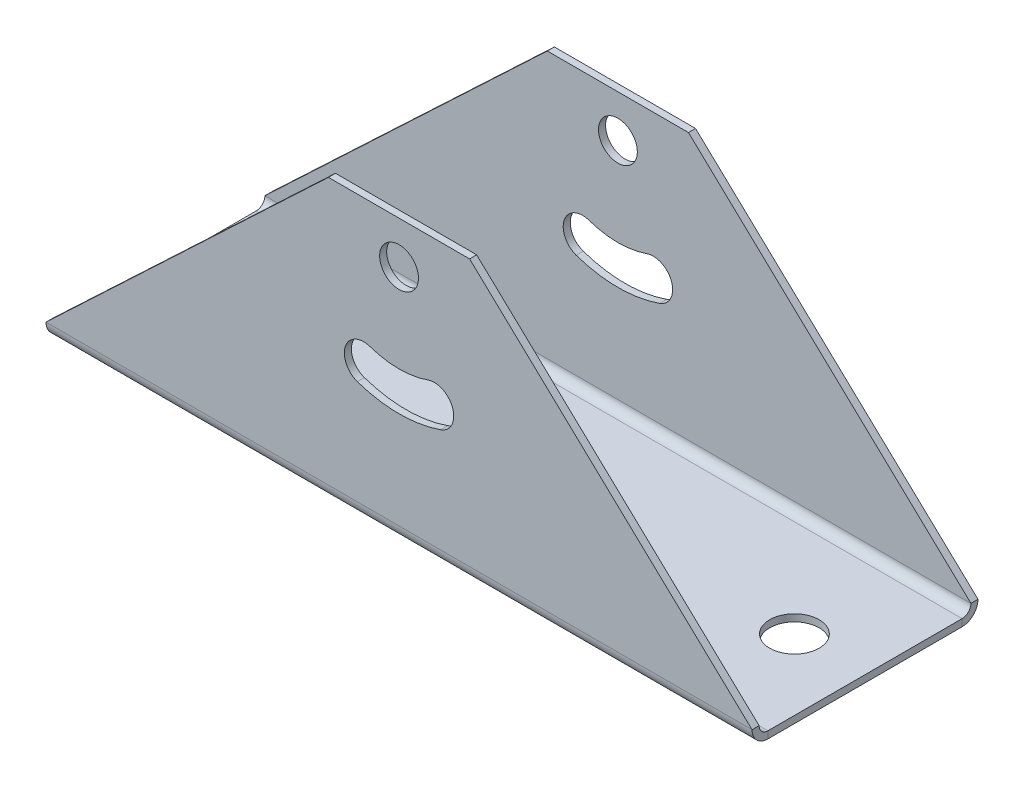
from build123d import *

# Parameters (mm, degrees)
SKETCH9_W                      = 200
SKETCH9_H                      = 64
BASE_FLANGE2_DEPTH             = 2
EDGE_FLANGE2_STRIP_W           = 13
EDGE_FLANGE2_STRIP_H           = 2
EDGE_FLANGE2_STRIP_CUT_DEPTH   = 200
EDGE_FLANGE2_STRIP_2_W         = 13
EDGE_FLANGE2_STRIP_2_H         = 2
EDGE_FLANGE2_STRIP_CUT_2_DEPTH = 200
EDGE_FLANGE2_DEPTH             = 200
EDGE_FLANGE2_BEND_DEPTH        = 200
CUT_EXTRUDE1_DEPTH             = 143.056326857
SKETCH21_R                     = 5.5
CUT_EXTRUDE2_DEPTH             = 143.056326857
CUT_EXTRUDE3_DEPTH             = 143.056326857
SKETCH23_R                     = 7
CUT_EXTRUDE4_DEPTH             = 10


# Sheet-metal steps are written as plain solids
with BuildPart() as part:
    # Sketch9 → Base-Flange2 (new body)
    with BuildSketch(Plane(origin=(0, 0, 0), x_dir=(1, 0, 0), z_dir=(0, 1, 0))):
        Rectangle(SKETCH9_W, SKETCH9_H)
    extrude(amount=-BASE_FLANGE2_DEPTH)

    # Edge-Flange2 strip (across the edge) → Edge-Flange2 strip cut (cut)
    with BuildSketch(Plane(origin=(-100, 0, 32), x_dir=(0, 0, -1), z_dir=(1, 0, 0))):
        with Locations((-2, -1)):
            Rectangle(EDGE_FLANGE2_STRIP_W, EDGE_FLANGE2_STRIP_H)
    extrude(amount=EDGE_FLANGE2_STRIP_CUT_DEPTH, mode=Mode.SUBTRACT)

    # Edge-Flange2 strip 2 (across the edge) → Edge-Flange2 strip cut 2 (cut)
    with BuildSketch(Plane(origin=(100, 0, -32), x_dir=(0, 0, 1), z_dir=(-1, 0, 0))):
        with Locations((-2, -1)):
            Rectangle(EDGE_FLANGE2_STRIP_2_W, EDGE_FLANGE2_STRIP_2_H)
    extrude(amount=EDGE_FLANGE2_STRIP_CUT_2_DEPTH, mode=Mode.SUBTRACT)

    # Edge-Flange2 section (across the edge) → Edge-Flange2 (add)
    with BuildSketch(Plane(origin=(-100, 0, 32), x_dir=(0, 0, -1), z_dir=(1, 0, 0))):
        with BuildLine():
            Line((0, 2.5), (0, 78))
            Line((0, 78), (2, 78))
            Line((2, 78), (2, 2.5))
            ThreePointArc((2, 2.5), (2.732233047, 0.732233047), (4.5, 0))
            Line((4.5, 0), (4.5, -2))
            ThreePointArc((4.5, -2), (1.318019485, -0.681980515), (0, 2.5))
        make_face()
    extrude(amount=EDGE_FLANGE2_DEPTH)

    # Edge-Flange2 section 2 (across the edge) → Edge-Flange2 bend (add)
    with BuildSketch(Plane(origin=(100, 0, -32), x_dir=(0, 0, 1), z_dir=(-1, 0, 0))):
        with BuildLine():
            Line((0, 2.5), (0, 78))
            Line((0, 78), (2, 78))
            Line((2, 78), (2, 2.5))
            ThreePointArc((2, 2.5), (2.732233047, 0.732233047), (4.5, 0))
            Line((4.5, 0), (4.5, -2))
            ThreePointArc((4.5, -2), (1.318019485, -0.681980515), (0, 2.5))
        make_face()
    extrude(amount=EDGE_FLANGE2_BEND_DEPTH)

    # Sketch20 → Cut-Extrude1 (cut, through all)
    with BuildSketch(Plane.XY.offset(32)):
        Polygon((-100, 2.5), (-20, 78), (-100, 78), align=None)
    cut_extrude1 = extrude(amount=-CUT_EXTRUDE1_DEPTH, mode=Mode.SUBTRACT)

    # Mirror1: Cut-Extrude1 across plane
    add(cut_extrude1.mirror(Plane(origin=(0, 0, 0), x_dir=(0, 0, 1), z_dir=(1, 0, 0))), mode=Mode.SUBTRACT)

    # Sketch21 → Cut-Extrude2 (cut, through all)
    with BuildSketch(Plane.XY.offset(32)):
        with Locations((0, 66)):
            Circle(SKETCH21_R)
    extrude(amount=-CUT_EXTRUDE2_DEPTH, mode=Mode.SUBTRACT)

    # Sketch22 → Cut-Extrude3 (cut, through all)
    with BuildSketch(Plane.XY.offset(32)):
        with BuildLine():
            ThreePointArc((-11.803278689, 31.989963067), (0, 30), (11.803278689, 31.989963067))
            ThreePointArc((11.803278689, 31.989963067), (15.195977865, 38.98921962), (8.196721311, 42.381918796))
            ThreePointArc((8.196721311, 42.381918796), (0, 41), (-8.196721311, 42.381918796))
            ThreePointArc((-8.196721311, 42.381918796), (-15.195977865, 38.98921962), (-11.803278689, 31.989963067))
        make_face()
    extrude(amount=-CUT_EXTRUDE3_DEPTH, mode=Mode.SUBTRACT)

    # Sketch23 → Cut-Extrude4 (cut)
    with BuildSketch(Plane(origin=(0, 0, 0), x_dir=(1, 0, 0), z_dir=(0, 1, 0))):
        with Locations(Location((-80, 0, 0), (0, 0, 270))):
            Circle(SKETCH23_R)
        with Locations(Location((80, 0, 0), (0, 0, 270))):
            Circle(SKETCH23_R)
    extrude(amount=-CUT_EXTRUDE4_DEPTH, mode=Mode.SUBTRACT)


solid = part.part
